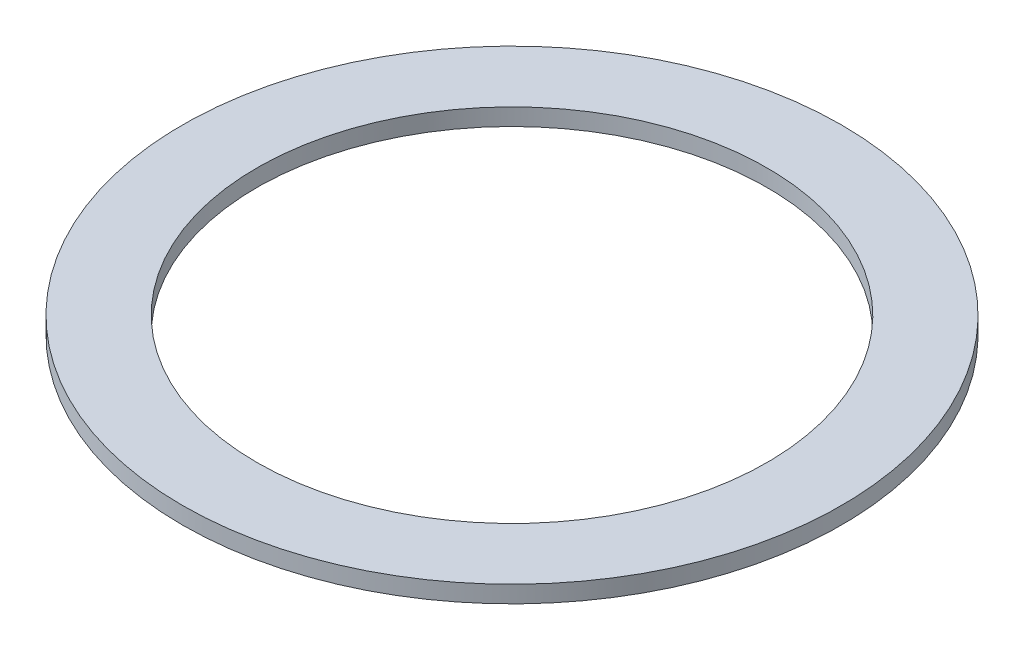
from build123d import *

# Parameters (mm, degrees)
SKETCH1_R           = 77.5
SKETCH1_R_2         = 60
BOSS_EXTRUDE1_DEPTH = 4


with BuildPart() as part:
    # Sketch1 → Boss-Extrude1 (new body)
    with BuildSketch(Plane(origin=(0, 0, 0), x_dir=(1, 0, 0), z_dir=(0, 1, 0))):
        Circle(SKETCH1_R)
        Circle(SKETCH1_R_2, mode=Mode.SUBTRACT)
    extrude(amount=BOSS_EXTRUDE1_DEPTH)


solid = part.part
